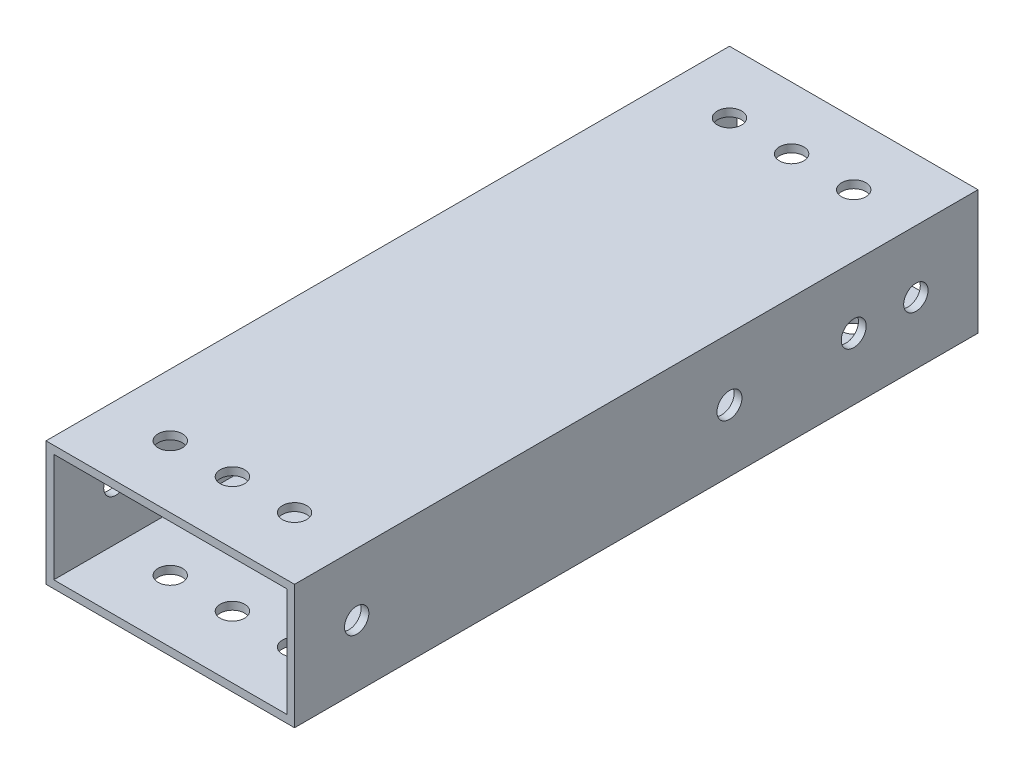
from build123d import *

# Parameters (mm, degrees)
SKETCH1_W           = 50.8
SKETCH1_H           = 25.4
SKETCH1_W_2         = 47.625
SKETCH1_H_2         = 22.225
BOSS_EXTRUDE1_DEPTH = 69.85
SKETCH2_R           = 2.4892
CUT_EXTRUDE1_DEPTH  = 79.545162168
SKETCH3_R           = 2.4892
CUT_EXTRUDE2_DEPTH  = 88.298066989
SKETCH5_R           = 2.5527
CUT_EXTRUDE3_DEPTH  = 88.298066989


with BuildPart() as part:
    # Sketch1 → Boss-Extrude1 (new, symmetric)
    with BuildSketch(Plane.XY):
        Rectangle(SKETCH1_W, SKETCH1_H)
        Rectangle(SKETCH1_W_2, SKETCH1_H_2, mode=Mode.SUBTRACT)
    extrude(amount=BOSS_EXTRUDE1_DEPTH, both=True)

    # Sketch2 → Cut-Extrude1 (cut, through all)
    with BuildSketch(Plane(origin=(0, 12.7, 0), x_dir=(1, 0, 0), z_dir=(0, 1, 0))):
        with Locations((-12.7, 57.15)):
            Circle(SKETCH2_R)
        with Locations((0, 57.15)):
            Circle(SKETCH2_R)
        with Locations((12.7, 57.15)):
            Circle(SKETCH2_R)
        with Locations((12.7, -57.15)):
            Circle(SKETCH2_R)
        with Locations((0, -57.15)):
            Circle(SKETCH2_R)
        with Locations((-12.7, -57.15)):
            Circle(SKETCH2_R)
    extrude(amount=-CUT_EXTRUDE1_DEPTH, mode=Mode.SUBTRACT)

    # Sketch3 → Cut-Extrude2 (cut, through all)
    with BuildSketch(Plane.ZY.offset(25.4)):
        with Locations((-57.15, 0)):
            Circle(SKETCH3_R)
        with Locations((57.15, 0)):
            Circle(SKETCH3_R)
    extrude(amount=-CUT_EXTRUDE2_DEPTH, mode=Mode.SUBTRACT)

    # Sketch5 → Cut-Extrude3 (cut, through all)
    with BuildSketch(Plane(origin=(25.4, 0, 0), x_dir=(0, 0, -1), z_dir=(1, 0, 0))):
        with Locations((44.45, 0)):
            Circle(SKETCH5_R)
        with Locations((19.05, 0)):
            Circle(SKETCH5_R)
    extrude(amount=-CUT_EXTRUDE3_DEPTH, mode=Mode.SUBTRACT)


solid = part.part
